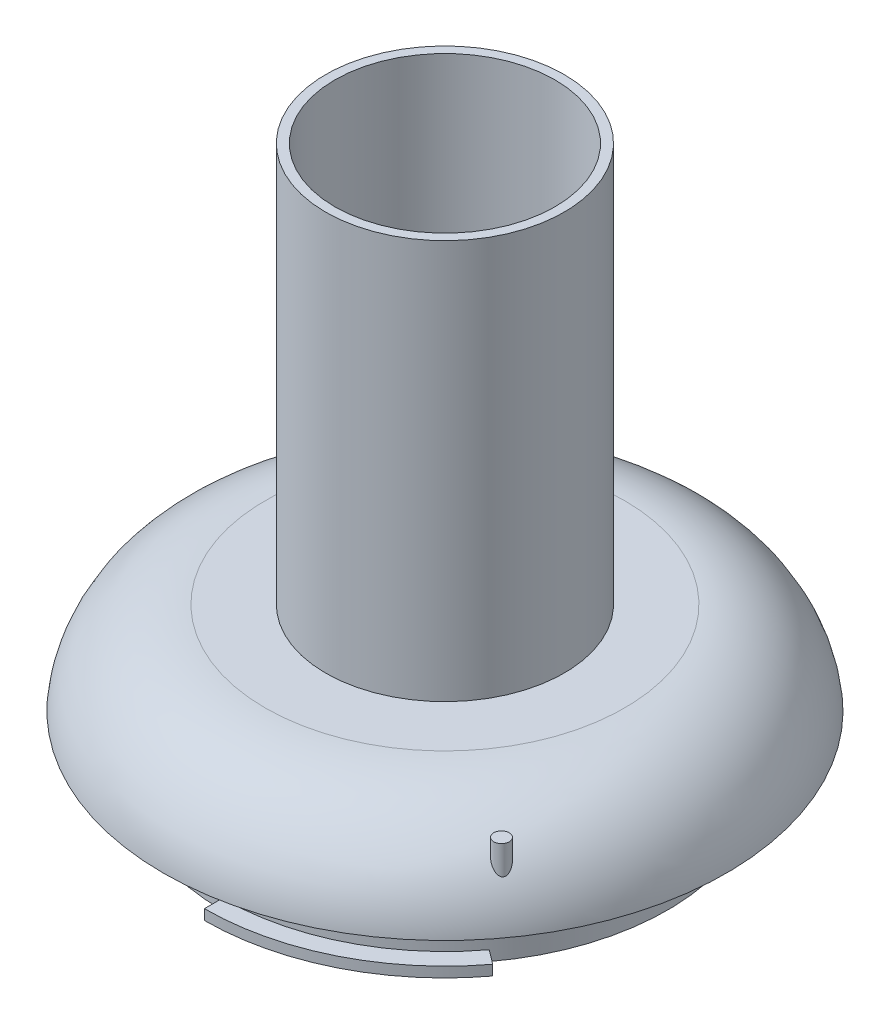
from build123d import *

# Parameters (mm, degrees)
SKETCH1_R           = 21.75
SKETCH1_R_2         = 20
BOSS_EXTRUDE1_DEPTH = 5
SKETCH2_R           = 23.5
SKETCH2_R_2         = 20
BOSS_EXTRUDE2_DEPTH = 1
SKETCH3_R           = 27.5
SKETCH3_R_2         = 20
BOSS_EXTRUDE3_DEPTH = 8
SKETCH4_R           = 11.65
SKETCH4_R_2         = 10.75
BOSS_EXTRUDE4_DEPTH = 40
SKETCH5_R           = 27.5
SKETCH5_R_2         = 11.65
BOSS_EXTRUDE5_DEPTH = 1
BOSS_EXTRUDE6_DEPTH = 1
CIRPATTERN1_COUNT   = 3
FILLET1_R           = 10
SKETCH8_R           = 0.761145908
BOSS_EXTRUDE7_DEPTH = 7
CHAMFER2_SIZE2      = 1
CHAMFER2_SIZE       = 2.475086853


# Some blends are built 0.0001 mm under size
with BuildPart() as part:
    # Sketch1 → Boss-Extrude1 (new body)
    with BuildSketch(Plane(origin=(0, 0, 0), x_dir=(1, 0, 0), z_dir=(0, 1, 0))):
        with Locations(Location((0, 0, 0), (0, 0, 270))):
            Circle(SKETCH1_R)
        with Locations(Location((0, 0, 0), (0, 0, 270))):
            Circle(SKETCH1_R_2, mode=Mode.SUBTRACT)
    boss_extrude1 = extrude(amount=BOSS_EXTRUDE1_DEPTH)

    # Sketch2 → Boss-Extrude2 (add)
    with BuildSketch(Plane(origin=(0, 5, 0), x_dir=(1, 0, 0), z_dir=(0, 1, 0))):
        with Locations(Location((0, 0, 0), (0, 0, 270))):
            Circle(SKETCH2_R)
        with Locations(Location((0, 0, 0), (0, 0, 270))):
            Circle(SKETCH2_R_2, mode=Mode.SUBTRACT)
    extrude(amount=BOSS_EXTRUDE2_DEPTH)

    # Sketch3 → Boss-Extrude3 (add)
    with BuildSketch(Plane(origin=(0, 6, 0), x_dir=(1, 0, 0), z_dir=(0, 1, 0))):
        with Locations(Location((0, 0, 0), (0, 0, 270))):
            Circle(SKETCH3_R)
        with Locations(Location((0, 0, 0), (0, 0, 270))):
            Circle(SKETCH3_R_2, mode=Mode.SUBTRACT)
    extrude(amount=BOSS_EXTRUDE3_DEPTH)



with BuildPart() as body_2:
    # Sketch4 → Boss-Extrude4 (new body)
    with BuildSketch(Plane(origin=(0, 14, 0), x_dir=(1, 0, 0), z_dir=(0, 1, 0))):
        with Locations(Location((0, 0, 0), (0, 0, 270))):
            Circle(SKETCH4_R)
        with Locations(Location((0, 0, 0), (0, 0, 270))):
            Circle(SKETCH4_R_2, mode=Mode.SUBTRACT)
    extrude(amount=BOSS_EXTRUDE4_DEPTH)


with BuildPart() as part_1:
    add(part.part)

    add(body_2.part)  # Boss-Extrude5 merges body 2
    # Sketch5 → Boss-Extrude5 (add)
    with BuildSketch(Plane(origin=(0, 14, 0), x_dir=(1, 0, 0), z_dir=(0, 1, 0))):
        with Locations(Location((0, 0, 0), (0, 0, 270))):
            Circle(SKETCH5_R)
        with Locations(Location((0, 0, 0), (0, 0, 270))):
            Circle(SKETCH5_R_2, mode=Mode.SUBTRACT)
    extrude(amount=BOSS_EXTRUDE5_DEPTH)

    # Sketch6 → Revolve1 (revolve)
    with BuildSketch(Plane.XY, mode=Mode.PRIVATE) as revolve1_sk:
        Polygon((10.75, 14), (20, 0), (20, 14), align=None)
    revolve(revolve1_sk.sketch.rotate(Axis((0, 0, 0), (0, 1, 0)), 90), axis=Axis((0, 0, 0), (0, 1, 0)))

    # Sketch7 → Boss-Extrude6 (add)
    with BuildSketch(Plane.XZ):
        with BuildLine():
            Line((0, 21.75), (0, 23.5))
            ThreePointArc((0, 23.5), (10.5, 21.023796042), (18.787221995, 14.117021277))
            Line((18.787221995, 14.117021277), (17.388173548, 13.065753735))
            ThreePointArc((17.388173548, 13.065753735), (9.718085106, 19.458194209), (0, 21.75))
        make_face()
    boss_extrude6 = extrude(amount=-BOSS_EXTRUDE6_DEPTH)

    # CirPattern1: Boss-Extrude1, Boss-Extrude6 ×3 about axis
    cirpattern1_axis = Axis((0, 0, 0), (0, 1, 0))
    add([boss_extrude1.rotate(cirpattern1_axis, i * 360 / CIRPATTERN1_COUNT) for i in range(1, CIRPATTERN1_COUNT)])
    add([boss_extrude6.rotate(cirpattern1_axis, i * 360 / CIRPATTERN1_COUNT) for i in range(1, CIRPATTERN1_COUNT)])

    # Fillet1
    # the kernel refuses this fillet: 10 mm, written as the material it takes off along each edge
    with BuildSketch(Plane(origin=(0, 15, 0), x_dir=(0, 0, 1), z_dir=(-1, 0, 0))) as fillet1_piece_1:
        with BuildLine():
            CenterArc((17.550125629, -10), FILLET1_R, 5.739170477, 84.260829523)
            Line((17.550125629, 0), (17.550125629, 0.2))
            Line((17.550125629, 0.2), (27.5, 0.2))
            Line((27.5, 0.2), (27.7, 0))
            ThreePointArc((27.7, 0), (27.7, -4.5), (27.698997487, -8.98))
            Line((27.698997487, -8.98), (27.5, -9))
        make_face()
    revolve(axis=Axis((0, 15, 0), (0, 1, 0)), mode=Mode.SUBTRACT)

    # Sketch8 → Boss-Extrude7 (add)
    with BuildSketch(Plane.XZ.offset(-6)):
        with Locations(Location((20.470368468, 14.946483104, 0), (0, 0, 270))):
            Circle(SKETCH8_R)
    extrude(amount=-BOSS_EXTRUDE7_DEPTH)

    # Chamfer2
    chamfer2_edges = [part_1.edges().sort_by_distance(p)[0] for p in [
        (0, 6, -23.5),
    ]]
    chamfer2_side = [part_1.faces().sort_by_distance(p)[0] for p in [
        (0, 6, -23.52),
    ]]
    chamfer(chamfer2_edges, length=CHAMFER2_SIZE - 0.0001, length2=CHAMFER2_SIZE2 - 0.0001, reference=chamfer2_side[0])  # a hair under: the kernel refuses the full size


solid = part_1.part
